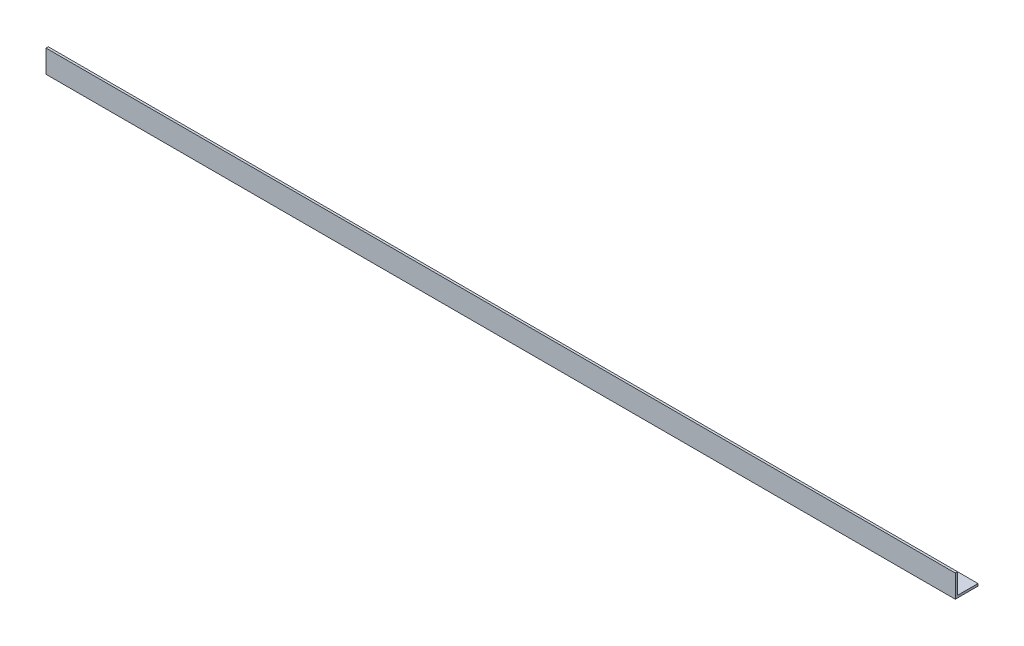
from build123d import *

# Parameters (mm, degrees)
EXTRUDE_1_DEPTH = 1200


with BuildPart() as part:
    # Эскиз1 → Вытянуть-Тонкостенный1 (new body)
    with BuildSketch(Plane(origin=(0, 0, 0), x_dir=(0, 0, -1), z_dir=(1, 0, 0))):
        Polygon((30, 0), (0, 0), (0, 30), (3, 30), (3, 3), (30, 3), align=None)
    extrude(amount=EXTRUDE_1_DEPTH)


solid = part.part
